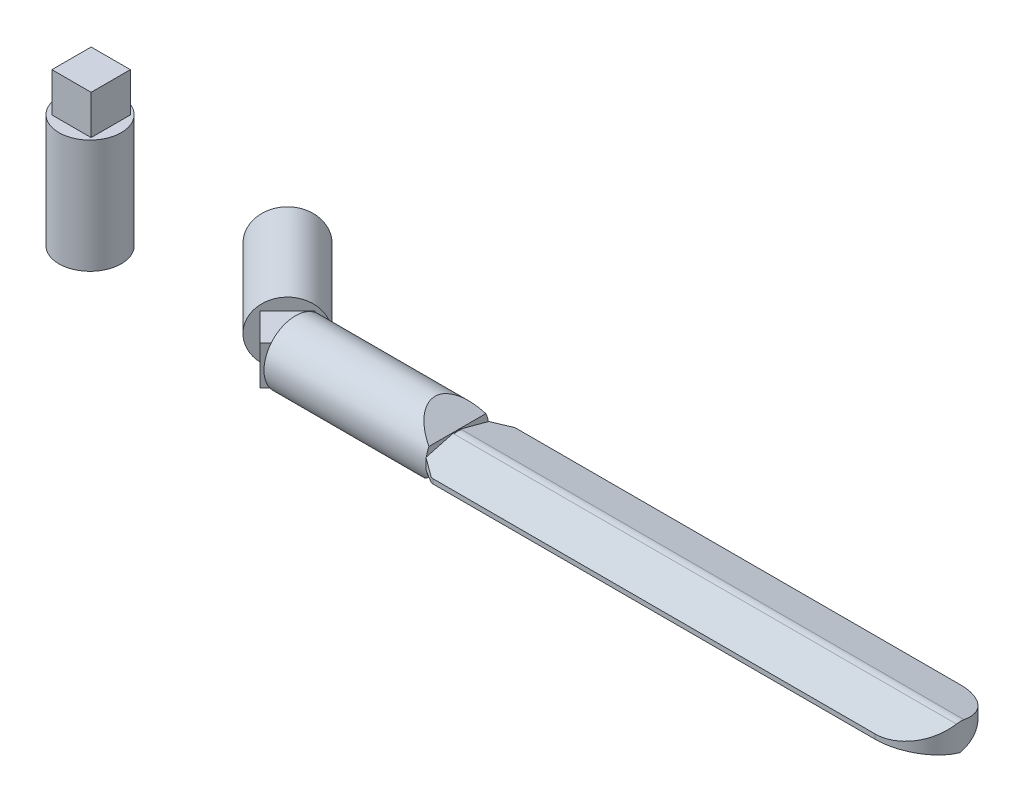
from build123d import *

# Parameters (mm, degrees)
BOSS_EXTRUDE2_DEPTH = 5.6
CHAMFER2_SIZE       = 2.328478482
CHAMFER2_SIZE_2     = 8.69
CHAMFER3_SIZE       = 8.69
CHAMFER3_SIZE_2     = 2.328478482
CHAMFER4_SIZE       = 8.69
CHAMFER4_SIZE_2     = 2.328478482
CHAMFER5_SIZE       = 8.69
CHAMFER5_SIZE_2     = 2.328478482
FILLET1_R           = 1
SKETCH8_R           = 6.42
BOSS_EXTRUDE3_DEPTH = 33.02
FILLET2_R           = 3
CUT_EXTRUDE12_DEPTH = 16
SKETCH21_R          = 6.36
BOSS_EXTRUDE4_DEPTH = 23.18
SKETCH22_W          = 8
SKETCH22_H          = 8
BOSS_EXTRUDE5_DEPTH = 8
SKETCH26_R          = 6.4262
BOSS_EXTRUDE6_DEPTH = 22.5552
SKETCH27_W          = 7.9756
SKETCH27_H          = 7.9756
BOSS_EXTRUDE7_DEPTH = 7.9756


with BuildPart() as part:
    # Sketch3 → Boss-Extrude2 (new body)
    with BuildSketch(Plane(origin=(0, 0, 0), x_dir=(1, 0, 0), z_dir=(0, 1, 0))):
        with BuildLine():
            Line((-55.958218902, 0), (34.866239796, 0))
            ThreePointArc((34.866239796, 0), (43.555159042, -8.688919246), (34.866239796, -17.377838493))
            Line((34.866239796, -17.377838493), (-55.633760204, -17.377838493))
            Line((-55.633760204, -17.377838493), (-59.133760204, -14.977838493))
            Line((-59.133760204, -14.977838493), (-59.132241437, -8.577838493))
            Line((-59.132241437, -8.577838493), (-59.132241437, -2.173298587))
            Line((-59.132241437, -2.173298587), (-55.958218902, 0))
        make_face()
    extrude(amount=BOSS_EXTRUDE2_DEPTH)

    # Chamfer2
    # the kernel refuses this chamfer: 8.69, 2.328478482 mm, written as the material it takes off along each edge
    with BuildSketch(Plane(origin=(57.431750241, 5.6, 17.377838493), x_dir=(0, -0.9905000388259545, 0.13751244702128881), z_dir=(-1, 0, 0))) as chamfer2_piece_1:
        Polygon((CHAMFER2_SIZE * 0.990500038922, -CHAMFER2_SIZE * 0.137512447035), (-CHAMFER2_SIZE_2 * 0.137512447021, -CHAMFER2_SIZE_2 * 0.990500038826), (0, 0), align=None)
    extrude(amount=135.63102089, mode=Mode.SUBTRACT)

    # Chamfer3
    # the kernel refuses this chamfer: 8.69, 2.328478482 mm, written as the material it takes off along each edge
    with BuildSketch(Plane(origin=(57.431750241, 0, 17.377838493), x_dir=(0, -0.009967146577156423, -0.9999503267608394), z_dir=(-1, 0, 0))) as chamfer3_piece_1:
        Polygon((CHAMFER3_SIZE * 0.999950326761, -CHAMFER3_SIZE * 0.00996714657716), (-CHAMFER3_SIZE_2 * 0.00996714657813, -CHAMFER3_SIZE_2 * 0.999950326858), (0, 0), align=None)
    extrude(amount=135.63102089, mode=Mode.SUBTRACT)

    # Chamfer4
    # the kernel refuses this chamfer: 8.69, 2.328478482 mm, written as the material it takes off along each edge
    with BuildSketch(Plane(origin=(-78.523729347, 5.6, 0), x_dir=(0, 0.00996714657715643, 0.9999503267608394), z_dir=(1, 0, 0))) as chamfer4_piece_1:
        Polygon((CHAMFER4_SIZE * 0.999950326761, CHAMFER4_SIZE * 0.00996714657716), (-CHAMFER4_SIZE_2 * 0.00996714657813, CHAMFER4_SIZE_2 * 0.999950326858), (0, 0), align=None)
    extrude(amount=135.955479588, mode=Mode.SUBTRACT)

    # Chamfer5
    # the kernel refuses this chamfer: 8.69, 2.328478482 mm, written as the material it takes off along each edge
    with BuildSketch(Plane(origin=(-78.523729347, 0, 0), x_dir=(0, -0.009967146577156423, 0.9999503267608394), z_dir=(1, 0, 0))) as chamfer5_piece_1:
        Polygon((CHAMFER5_SIZE * 0.999950326761, -CHAMFER5_SIZE * 0.00996714657716), (-CHAMFER5_SIZE_2 * 0.00996714657813, -CHAMFER5_SIZE_2 * 0.999950326858), (0, 0), align=None)
    extrude(amount=135.955479588, mode=Mode.SUBTRACT)

    # Fillet1
    fillet1_edges = [part.edges().sort_by_distance(p)[0] for p in [
        (-55.633760204, 2.8, 17.377838493),
    ]]
    fillet(fillet1_edges, radius=FILLET1_R)

    # Sketch8 → Boss-Extrude3 (add)
    with BuildSketch(Plane(origin=(-59.130202523, 0, -0.014032034), x_dir=(-0.00023730738394525297, 0, 0.9999999718426024), z_dir=(-0.9999999718426024, 0, -0.00023730738394525297))):
        with Locations(Location((8.591870769, 2.8, 0), (0, 0, 183.840787638))):
            Circle(SKETCH8_R)
    extrude(amount=BOSS_EXTRUDE3_DEPTH)

    # Fillet2
    fillet2_edges = [part.edges().sort_by_distance(p)[0] for p in [
        (-7.788554378, 5.599710413, 8.688919246),
    ]]
    fillet(fillet2_edges, radius=FILLET2_R)

    # Sketch16 → Cut-Extrude12 (cut)
    with BuildSketch(Plane.XY):
        Polygon((-58.943650552, 9.22), (-63.693726721, 9.22), (-58.943650552, 5.391659351), align=None)
        Polygon((-58.943650552, -3.62), (-63.693726721, -3.62), (-58.943650552, 0.208340649), align=None)
    extrude(amount=CUT_EXTRUDE12_DEPTH, mode=Mode.SUBTRACT)



with BuildPart() as body_2:
    # Sketch21 → Boss-Extrude4 (new body)
    with BuildSketch(Plane(origin=(0, 0, 0), x_dir=(1, 0, 0), z_dir=(0, 1, 0))):
        with Locations(Location((-134.647466818, -7.957912817, 0), (0, 0, 270))):
            Circle(SKETCH21_R)
    extrude(amount=BOSS_EXTRUDE4_DEPTH)

    # Sketch22 → Boss-Extrude5 (add)
    with BuildSketch(Plane(origin=(0, 23.18, 0), x_dir=(1, 0, 0), z_dir=(0, 1, 0))):
        with Locations((-134.479881672, -7.906897789)):
            Rectangle(SKETCH22_W, SKETCH22_H)
    extrude(amount=BOSS_EXTRUDE5_DEPTH)


with BuildPart() as body_3:
    # Sketch26 → Boss-Extrude6 (new body)
    with BuildSketch(Plane(origin=(-45.05425196, 0, -45.075640449), x_dir=(0, 1, 0), z_dir=(0.7069389596158512, 0, 0.7072745629366703))):
        with Locations(Location((2.801295813, 72.39, 0), (0, 0, 270))):
            Circle(SKETCH26_R)
    extrude(amount=-BOSS_EXTRUDE6_DEPTH)


with BuildPart() as part_1:
    add(part.part)

    add(body_3.part)  # Boss-Extrude7 merges body 3
    # Sketch27 → Boss-Extrude7 (add)
    with BuildSketch(Plane(origin=(-45.05425196, 0, -45.075640449), x_dir=(0, 1, 0), z_dir=(0.7069389596158512, 0, 0.7072745629366703))):
        with Locations((2.801295813, 72.39)):
            Rectangle(SKETCH27_W, SKETCH27_H)
    extrude(amount=BOSS_EXTRUDE7_DEPTH)


solid = Compound([body_2.part, part_1.part])
